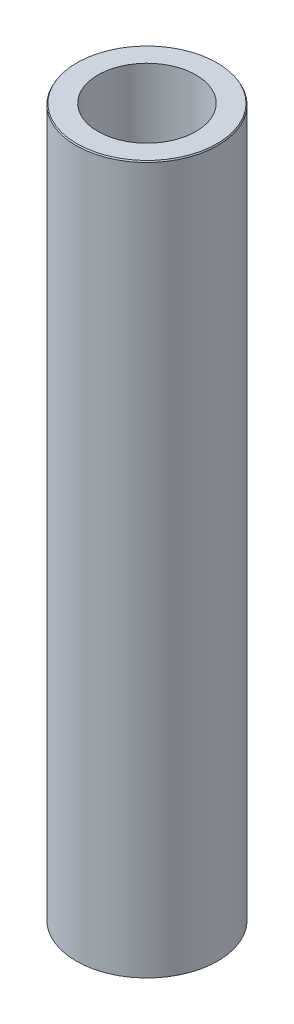
from build123d import *
from OCP.BRepFilletAPI import BRepFilletAPI_MakeChamfer

# Parameters (mm, degrees)
SKETCH1_R           = 60
BOSS_EXTRUDE1_DEPTH = 600
SKETCH2_R           = 41.51150256
CUT_EXTRUDE1_DEPTH  = 606.970296302
CHAMFER1_SIZE       = 1.090211841
CHAMFER1_SIZE2      = 0.6294341


with BuildPart() as part:
    # Sketch1 → Boss-Extrude1 (new body)
    with BuildSketch(Plane(origin=(0, 0, 0), x_dir=(1, 0, 0), z_dir=(0, 1, 0))):
        Circle(SKETCH1_R)
    extrude(amount=BOSS_EXTRUDE1_DEPTH)

    # Sketch2 → Cut-Extrude1 (cut, through all)
    with BuildSketch(Plane(origin=(0, 0, 0), x_dir=(1, 0, 0), z_dir=(0, 1, 0))):
        Circle(SKETCH2_R)
    extrude(amount=CUT_EXTRUDE1_DEPTH, mode=Mode.SUBTRACT)

    # Chamfer1: one chamfer whose edges measure the first distance from different faces: ONE call of the kernel's chamfer builder (chamfer() names one face for all edges)
    chamfer1_edges_1 = [part.edges().sort_by_distance(p)[0] for p in [
        (-60, 600, 0),
    ]]
    chamfer1_side_1 = [part.faces().sort_by_distance(p)[0] for p in [
        (-60, 300, 0),
    ]]
    chamfer1_edges_2 = [part.edges().sort_by_distance(p)[0] for p in [
        (-60, 0, 0),
    ]]
    chamfer1_side_2 = [part.faces().sort_by_distance(p)[0] for p in [
        (-58.302943725, 0, 0),
    ]]
    chamfer1 = BRepFilletAPI_MakeChamfer(part.part.solid().wrapped)
    for e in chamfer1_edges_1:
        chamfer1.Add(CHAMFER1_SIZE, CHAMFER1_SIZE2, e.wrapped, chamfer1_side_1[0].wrapped)  # the first distance lies on this face
    for e in chamfer1_edges_2:
        chamfer1.Add(CHAMFER1_SIZE, CHAMFER1_SIZE2, e.wrapped, chamfer1_side_2[0].wrapped)  # the first distance lies on this face
    add(Compound.cast(chamfer1.Shape()), mode=Mode.REPLACE)


solid = part.part
